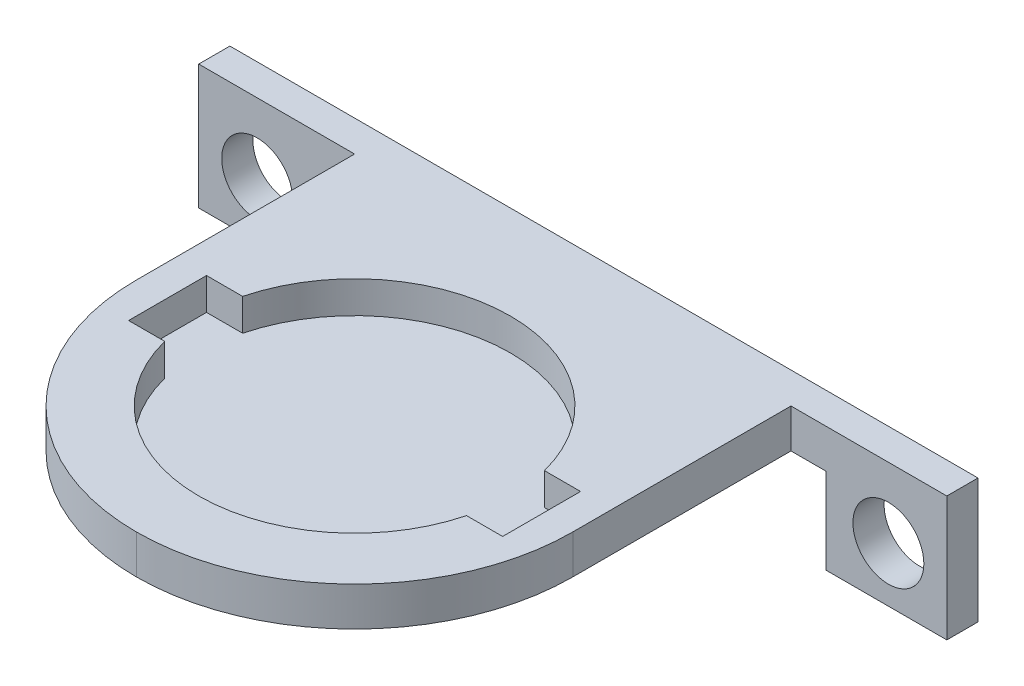
from build123d import *

# Parameters (mm, degrees)
SKETCH_1_W          = 96
SKETCH_1_H          = 16
EXTRUDE_1_DEPTH     = 4
SKETCH_2_W          = 56
SKETCH_2_H          = 5
EXTRUDE_2_DEPTH     = 56
SKETCH_3_W          = 65
SKETCH_3_H          = 11
CUT_EXTRUDE_1_DEPTH = 50
SKETCH_4_R          = 4.55
CUT_EXTRUDE_2_DEPTH = 75.188947964
FILLET_1_R          = 28
CUT_EXTRUDE_3_DEPTH = 4.1


with BuildPart() as part:
    # 스케치1 → 보스-돌출1 (new body)
    with BuildSketch(Plane.XY):
        Rectangle(SKETCH_1_W, SKETCH_1_H)
    extrude(amount=EXTRUDE_1_DEPTH)

    # 스케치2 → 보스-돌출2 (add)
    with BuildSketch(Plane.XY.offset(4)):
        with Locations((0, 5.5)):
            Rectangle(SKETCH_2_W, SKETCH_2_H)
    extrude(amount=EXTRUDE_2_DEPTH)

    # 스케치3 → 컷-돌출1 (cut)
    with BuildSketch(Plane.XY.offset(4)):
        with Locations((0, -2.5)):
            Rectangle(SKETCH_3_W, SKETCH_3_H)
    extrude(amount=-CUT_EXTRUDE_1_DEPTH, mode=Mode.SUBTRACT)

    # 스케치4 → 컷-돌출2 (cut, through all)
    with BuildSketch(Plane.XY.offset(4)):
        with Locations((40.5, -1)):
            Circle(SKETCH_4_R)
        with Locations((-40.5, -1)):
            Circle(SKETCH_4_R)
    extrude(amount=-CUT_EXTRUDE_2_DEPTH, mode=Mode.SUBTRACT)

    # 필렛1
    fillet_1_edges = [part.edges().sort_by_distance(p)[0] for p in [
        (-28, 5.5, 60),
        (28, 5.5, 60),
    ]]
    fillet(fillet_1_edges, radius=FILLET_1_R - 0.0001)  # a hair under: the kernel refuses the full size

    # 스케치5 → 컷-돌출3 (cut)
    with BuildSketch(Plane(origin=(0, 8, 0), x_dir=(1, 0, 0), z_dir=(0, 1, 0))):
        with BuildLine():
            Line((-19.364916731, -27), (-16, -27))
            Line((-16, -27), (-16, -37))
            Line((-16, -37), (-19.364916731, -37))
            ThreePointArc((-19.364916731, -37), (0, -52), (19.364916731, -37))
            Line((19.364916731, -37), (16, -37))
            Line((16, -37), (16, -27))
            Line((16, -27), (19.364916731, -27))
            ThreePointArc((19.364916731, -27), (0, -12), (-19.364916731, -27))
        make_face()
        with BuildLine():
            ThreePointArc((20, -32), (19.840593925, -29.47991415), (19.364916731, -27))
            Line((19.364916731, -27), (16, -27))
            Line((16, -27), (16, -37))
            Line((16, -37), (19.364916731, -37))
            ThreePointArc((19.364916731, -37), (19.840593925, -34.52008585), (20, -32))
        make_face()
        with BuildLine():
            Line((24, -27), (19.364916731, -27))
            ThreePointArc((19.364916731, -27), (19.840593925, -29.47991415), (20, -32))
            ThreePointArc((20, -32), (19.840593925, -34.52008585), (19.364916731, -37))
            Line((19.364916731, -37), (24, -37))
            Line((24, -37), (24, -27))
        make_face()
        with BuildLine():
            Line((-16, -37), (-16, -27))
            Line((-16, -27), (-19.364916731, -27))
            ThreePointArc((-19.364916731, -27), (-20, -32), (-19.364916731, -37))
            Line((-19.364916731, -37), (-16, -37))
        make_face()
        with BuildLine():
            ThreePointArc((-19.364916731, -37), (-20, -32), (-19.364916731, -27))
            Line((-19.364916731, -27), (-24, -27))
            Line((-24, -27), (-24, -37))
            Line((-24, -37), (-19.364916731, -37))
        make_face()
    extrude(amount=-CUT_EXTRUDE_3_DEPTH, mode=Mode.SUBTRACT)


solid = part.part
